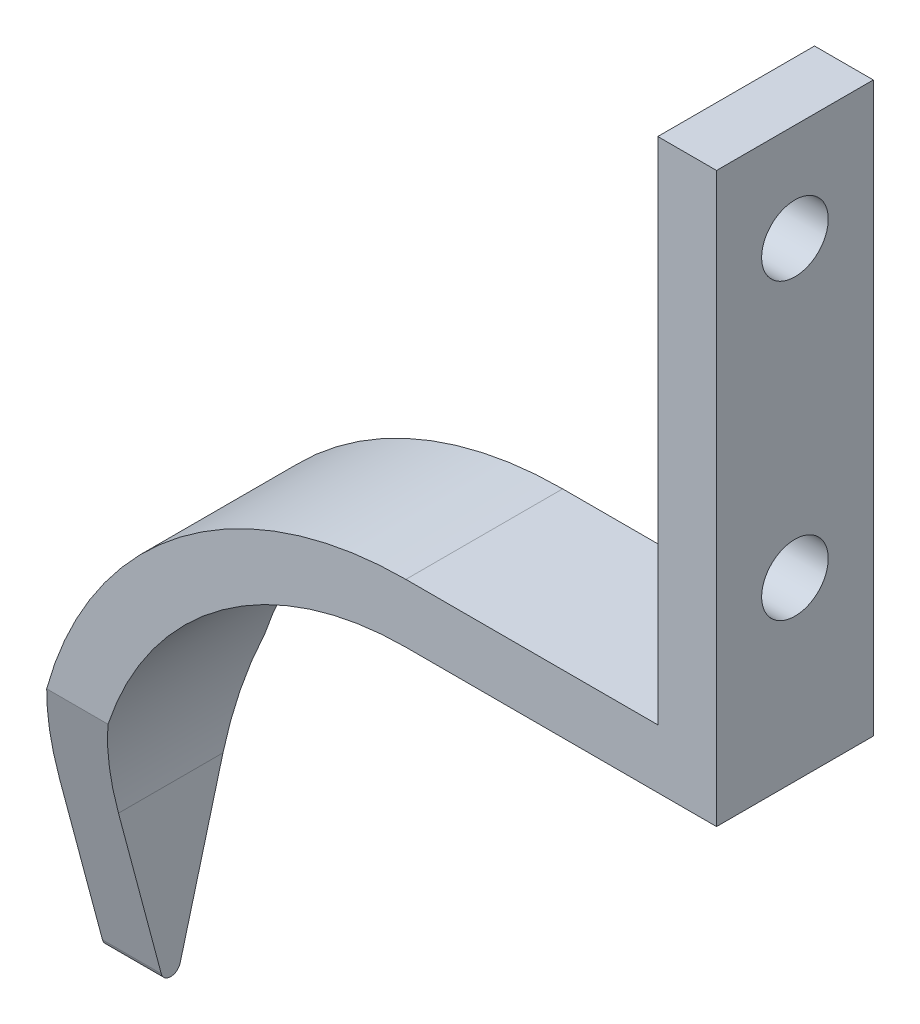
from build123d import *

# Parameters (mm, degrees)
BOSS_EXTRUDE1_DEPTH = 4
CUT_EXTRUDE1_DEPTH  = 106.97580396
FILLET1_R           = 0.5
SKETCH3_R           = 1.7
CUT_EXTRUDE2_DEPTH  = 106.027334656


with BuildPart() as part:
    # Sketch1 → Boss-Extrude1 (new, symmetric)
    with BuildSketch(Plane(origin=(0, 0, 0), x_dir=(-1, 0, 0), z_dir=(0, 0, -1))):
        with BuildLine():
            Line((27.145, 100), (24.145, 100))
            Line((24.145, 100), (24.145, 71))
            Line((24.145, 71), (40, 71))
            ThreePointArc((40, 71), (51.313708499, 66.313708499), (56, 55))
            Line((56, 55), (56, 45))
            Line((56, 45), (59, 45))
            Line((59, 45), (59, 55))
            ThreePointArc((59, 55), (53.435028843, 68.435028843), (40, 74))
            Line((40, 74), (27.145, 74))
            Line((27.145, 74), (27.145, 100))
        make_face()
    extrude(amount=BOSS_EXTRUDE1_DEPTH, both=True)

    # Sketch2 → Cut-Extrude1 (cut, through all)
    with BuildSketch(Plane.ZY.offset(59)):
        Polygon((4, 60), (0, 45), (4, 45), align=None)
        Polygon((-4, 60), (-4, 45), (0, 45), align=None)
    extrude(amount=-CUT_EXTRUDE1_DEPTH, mode=Mode.SUBTRACT)

    # Fillet1
    fillet1_edges = [part.edges().sort_by_distance(p)[0] for p in [
        (-57.5, 45, 0),
    ]]
    fillet(fillet1_edges, radius=FILLET1_R)

    # Sketch3 → Cut-Extrude2 (cut, through all)
    with BuildSketch(Plane.ZY.offset(27.145)):
        with Locations((0, 80)):
            Circle(SKETCH3_R)
        with Locations((0, 95)):
            Circle(SKETCH3_R)
    extrude(amount=-CUT_EXTRUDE2_DEPTH, mode=Mode.SUBTRACT)


solid = part.part
